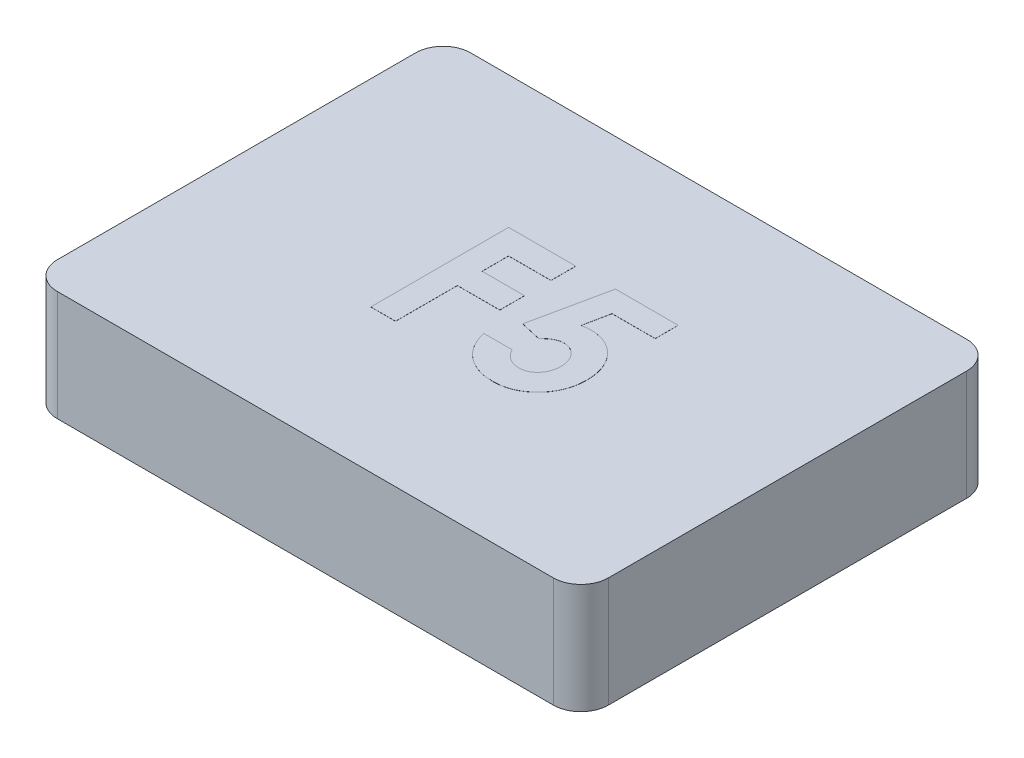
from build123d import *

# Parameters (mm, degrees)
SKETCH1_W           = 12.7
SKETCH1_H           = 9.525
BOSS_EXTRUDE1_DEPTH = 2.54
FILLET1_R           = 0.635
SHELL1_START        = 0.635
SHELL1_OUTLINE_W    = 1.905
SHELL1_OUTLINE_H    = 8.255
SHELL1_DEPTH        = 11.43
SKETCH2_R           = 2.54
BOSS_EXTRUDE2_DEPTH = 1.905
BOSS_EXTRUDE3_DEPTH = 0.00254


# Read off the part's stored shape, not the designer's step: Shell1
with BuildPart() as part:
    # Sketch1 → Boss-Extrude1 (new body)
    with BuildSketch(Plane(origin=(0, 0, 0), x_dir=(1, 0, 0), z_dir=(0, 1, 0))):
        with Locations((6.35, 4.7625)):
            Rectangle(SKETCH1_W, SKETCH1_H)
    extrude(amount=BOSS_EXTRUDE1_DEPTH)

    # Fillet1
    fillet1_edges = [part.edges().sort_by_distance(p)[0] for p in [
        (0, 1.27, -9.525),
        (12.7, 1.27, -9.525),
        (12.7, 1.27, 0),
        (0, 1.27, 0),
    ]]
    fillet(fillet1_edges, radius=FILLET1_R)

    # Shell1 outline → Shell1 (cut)
    with BuildSketch(Plane.YZ.offset(SHELL1_START)):
        with Locations((0.9525, -4.7625)):
            Rectangle(SHELL1_OUTLINE_W, SHELL1_OUTLINE_H)
    extrude(amount=SHELL1_DEPTH, mode=Mode.SUBTRACT)

    # Sketch2 → Boss-Extrude2 (add)
    with BuildSketch(Plane(origin=(0, 1.905, 0), x_dir=(-1, 0, 0), z_dir=(0, -1, 0))):
        with Locations(Location((-6.35, 4.7625, 0), (0, 0, 270))):
            Circle(SKETCH2_R)
    extrude(amount=BOSS_EXTRUDE2_DEPTH)

    # Sketch3 → Boss-Extrude3 (add)
    with BuildSketch(Plane(origin=(0, 2.54, 0), x_dir=(1, 0, 0), z_dir=(0, 1, 0))):
        Polygon((4.557346154, 6.477), (6.104141026, 6.477), (6.104141026, 5.907128205), (5.127217949, 5.907128205), (5.127217949, 5.296551282), (6.104141026, 5.296551282), (6.104141026, 4.726679487), (5.127217949, 4.726679487), (5.127217949, 3.302), (4.557346154, 3.302), align=None)
        with BuildLine():
            Line((7.019370393, 6.477), (8.465038462, 6.477))
            Line((8.465038462, 6.477), (8.465038462, 5.947833333))
            Line((8.465038462, 5.947833333), (7.470942909, 5.947833333))
            Line((7.470942909, 5.947833333), (7.346919471, 5.347432692))
            add(Edge.make_bspline(
                [(7.346919471, 5.347432692), (7.36381944, 5.352139547), (7.39714965, 5.361422431), (7.447361654, 5.37073199), (7.496024083, 5.37676615), (7.527956072, 5.377571026), (7.543448918, 5.377961538)],
                knots=[0, 0, 0, 0, 1.05461699, 2.079921384, 3.068411212, 4, 4, 4, 4], degree=3))
            add(Edge.make_bspline(
                [(7.543448918, 5.377961538), (7.577209453, 5.377187935), (7.643758905, 5.375662993), (7.741112308, 5.361186318), (7.834333943, 5.338385994), (7.92313854, 5.305868028), (8.00743935, 5.263545055), (8.087338562, 5.212346122), (8.162934239, 5.152181304), (8.232883484, 5.083012934), (8.297155771, 5.007064498), (8.35303686, 4.924918228), (8.400762796, 4.83774545), (8.438722356, 4.7450043), (8.468683277, 4.647277254), (8.490333708, 4.544501687), (8.503136689, 4.436555795), (8.504863092, 4.36291203), (8.50574359, 4.325352364)],
                knots=[0, 0, 0, 0, 1.01440847, 1.999622559, 2.951875003, 3.895578053, 4.836219714, 5.782137149, 6.743708247, 7.735272588, 8.734977101, 9.730283169, 10.717124674, 11.717316708, 12.737475749, 13.78628267, 14.87096371, 16, 16, 16, 16], degree=3))
            add(Edge.make_bspline(
                [(8.50574359, 4.325352364), (8.504667608, 4.287366309), (8.502544381, 4.212408718), (8.488692272, 4.102194546), (8.46424305, 3.99663425), (8.430659597, 3.895445249), (8.386415548, 3.799371256), (8.333206024, 3.707417017), (8.270131395, 3.62026508), (8.19781064, 3.538808856), (8.119188492, 3.464356304), (8.035474464, 3.398860252), (7.947256672, 3.343745854), (7.854532987, 3.299204103), (7.757835395, 3.263963462), (7.657134547, 3.238309958), (7.55194105, 3.223599099), (7.480528333, 3.221603885), (7.444230168, 3.220589744)],
                knots=[0, 0, 0, 0, 1.06808661, 2.107647099, 3.116961351, 4.110378221, 5.100014249, 6.085620622, 7.093190682, 8.119403071, 9.144090782, 10.133780668, 11.103064255, 12.062861538, 13.020824475, 13.992378307, 14.979551724, 16, 16, 16, 16], degree=3))
            add(Edge.make_bspline(
                [(7.444230168, 3.220589744), (7.4117698, 3.221419374), (7.34775116, 3.22305558), (7.253454513, 3.233112563), (7.162542075, 3.250893402), (7.07549649, 3.276626881), (6.991401894, 3.308298918), (6.911230444, 3.347910786), (6.834541583, 3.394708222), (6.761553081, 3.447837171), (6.693450895, 3.507684872), (6.631294436, 3.573198491), (6.574707401, 3.643552263), (6.524900663, 3.719614138), (6.482030353, 3.801271739), (6.444012086, 3.887562714), (6.412893755, 3.979388215), (6.397102098, 4.043046753), (6.389076923, 4.075397436)],
                knots=[0, 0, 0, 0, 1.054957082, 2.080596141, 3.077793124, 4.061112343, 5.027190972, 5.994718051, 6.962465889, 7.943658696, 8.924948258, 9.904494768, 10.875059, 11.855380583, 12.854004648, 13.869083016, 14.917087635, 16, 16, 16, 16], degree=3))
            Line((6.389076923, 4.075397436), (7.040358974, 4.075397436))
            add(Edge.make_bspline(
                [(7.040358974, 4.075397436), (7.052264426, 4.05297973), (7.075401313, 4.009413478), (7.119412786, 3.951572731), (7.168680836, 3.902248628), (7.222761039, 3.86095926), (7.2820038, 3.830025968), (7.343995088, 3.806567591), (7.409513675, 3.793011863), (7.454134726, 3.791317263), (7.476667067, 3.790461538)],
                knots=[0, 0, 0, 0, 1.104910296, 2.147267069, 3.153527244, 4.136738762, 5.099945312, 6.05603338, 7.018353, 8, 8, 8, 8], degree=3))
            add(Edge.make_bspline(
                [(7.476667067, 3.790461538), (7.492371807, 3.791052424), (7.523271148, 3.792215), (7.56879644, 3.79836532), (7.612252331, 3.810013887), (7.653961906, 3.826144445), (7.694037207, 3.846261072), (7.73190374, 3.871657003), (7.768220316, 3.900888661), (7.802434048, 3.934432088), (7.833421827, 3.971825207), (7.86059472, 4.012006662), (7.884891034, 4.054083613), (7.902887685, 4.099722833), (7.917625421, 4.147561519), (7.928478885, 4.197960534), (7.934965054, 4.250978738), (7.9355655, 4.28717278), (7.935871795, 4.305635817)],
                knots=[0, 0, 0, 0, 0.978869489, 1.925942215, 2.855067702, 3.774946051, 4.70828698, 5.642468714, 6.60995405, 7.609372294, 8.622401667, 9.629904756, 10.629323, 11.642352373, 12.678539694, 13.745912462, 14.850161547, 16, 16, 16, 16], degree=3))
            add(Edge.make_bspline(
                [(7.935871795, 4.305635817), (7.935516304, 4.323670285), (7.934824333, 4.358774815), (7.929100208, 4.410320838), (7.918859859, 4.459228686), (7.904907296, 4.505872956), (7.887046349, 4.549970401), (7.865219078, 4.59178351), (7.839332235, 4.631100934), (7.809246838, 4.667122208), (7.777164081, 4.700161945), (7.74269689, 4.729058236), (7.706155797, 4.753040151), (7.668676272, 4.77397706), (7.628762266, 4.789214487), (7.587311286, 4.79970794), (7.544366922, 4.807407614), (7.515075503, 4.807859998), (7.50019972, 4.808089744)],
                knots=[0, 0, 0, 0, 1.166249705, 2.270133367, 3.348514167, 4.393962215, 5.415026464, 6.420877785, 7.440098956, 8.453121383, 9.451844239, 10.415694839, 11.355045125, 12.27538808, 13.187007209, 14.108269027, 15.039275622, 16, 16, 16, 16], degree=3))
            add(Edge.make_bspline(
                [(7.50019972, 4.808089744), (7.484041161, 4.807476616), (7.451655945, 4.806247777), (7.403539618, 4.796249042), (7.35600344, 4.780067337), (7.308783062, 4.757742112), (7.262347227, 4.728525435), (7.21547047, 4.694257624), (7.169721857, 4.652448796), (7.140633617, 4.621309485), (7.125585337, 4.60520012)],
                knots=[0, 0, 0, 0, 0.88288272, 1.769486374, 2.674910571, 3.623812639, 4.617874466, 5.670434592, 6.794841017, 8, 8, 8, 8], degree=3))
            Line((7.125585337, 4.60520012), (6.646028045, 4.71523117))
            Line((6.646028045, 4.71523117), (7.019370393, 6.477))
        make_face()
    extrude(amount=BOSS_EXTRUDE3_DEPTH)


solid = part.part
